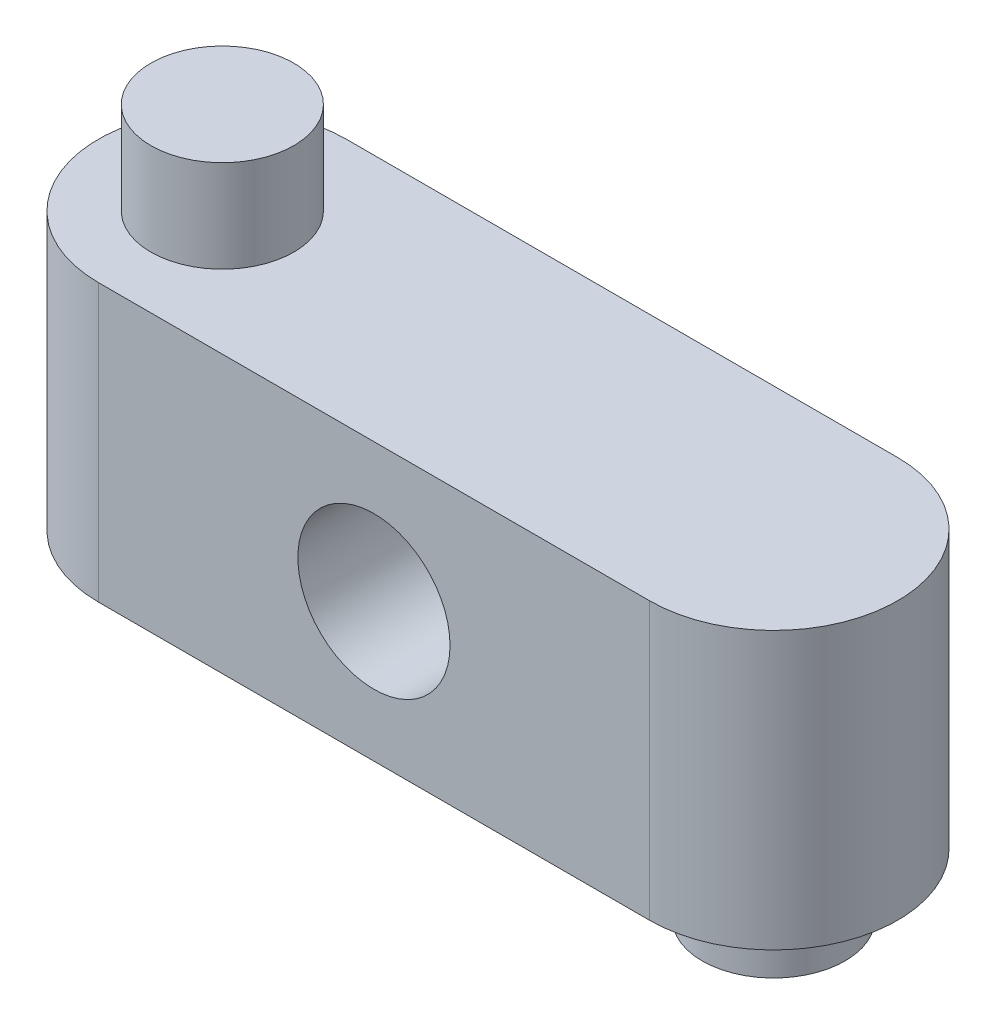
from build123d import *

# Parameters (mm, degrees)
BOSS_EXTRUDE2_DEPTH      = 9
CUT_EXTRUDE2_START       = -12.485338913
CUT_EXTRUDE2_OUTLINE_R   = 2.475
CUT_EXTRUDE2_DEPTH       = 8.07
BOSS_EXTRUDE3_DEPTH      = 9
BOSS_EXTRUDE3_DEPTH_BACK = 2
SKETCH1_6_R              = 2.325
SKETCH1_7_R              = 2.325
BOSS_EXTRUDE4_DEPTH      = 12


# Read off the part's stored shape, not the designer's step: Cut-Extrude2
with BuildPart() as part:
    # Sketch1 → Boss-Extrude2 (new body)
    with BuildSketch(Plane(origin=(0, 0, 0), x_dir=(1, 0, 0), z_dir=(0, 1, 0))):
        with BuildLine():
            Line((-49.891335879, 12.485338913), (-67.821335879, 12.485338913))
            ThreePointArc((-67.821335879, 12.485338913), (-71.856335879, 8.450338913), (-67.821335879, 4.415338913))
            Line((-67.821335879, 4.415338913), (-49.891335879, 4.415338913))
            ThreePointArc((-49.891335879, 4.415338913), (-45.856335879, 8.450338913), (-49.891335879, 12.485338913))
        make_face()
    extrude(amount=BOSS_EXTRUDE2_DEPTH)

    # Cut-Extrude2 outline → Cut-Extrude2 (cut)
    with BuildSketch(Plane.XY.offset(CUT_EXTRUDE2_START)):
        with Locations((-58.856335879, 4.5)):
            Circle(CUT_EXTRUDE2_OUTLINE_R)
    extrude(amount=CUT_EXTRUDE2_DEPTH, mode=Mode.SUBTRACT)

    # Sketch1<6> → Boss-Extrude3 (add, two sides: drawn at the far end of the back side and taken through both)
    with BuildSketch(Plane(origin=(0, 0, 0), x_dir=(1, 0, 0), z_dir=(0, 1, 0)).offset(-BOSS_EXTRUDE3_DEPTH_BACK)):
        with Locations(Location((-49.891335879, 8.450338913, 0), (0, 0, 270))):
            Circle(SKETCH1_6_R)
    extrude(amount=BOSS_EXTRUDE3_DEPTH + BOSS_EXTRUDE3_DEPTH_BACK)

    # Sketch1<7> → Boss-Extrude4 (add)
    with BuildSketch(Plane(origin=(0, 0, 0), x_dir=(1, 0, 0), z_dir=(0, 1, 0))):
        with Locations(Location((-67.821335879, 8.450338913, 0), (0, 0, 270))):
            Circle(SKETCH1_7_R)
    extrude(amount=BOSS_EXTRUDE4_DEPTH)


solid = part.part
